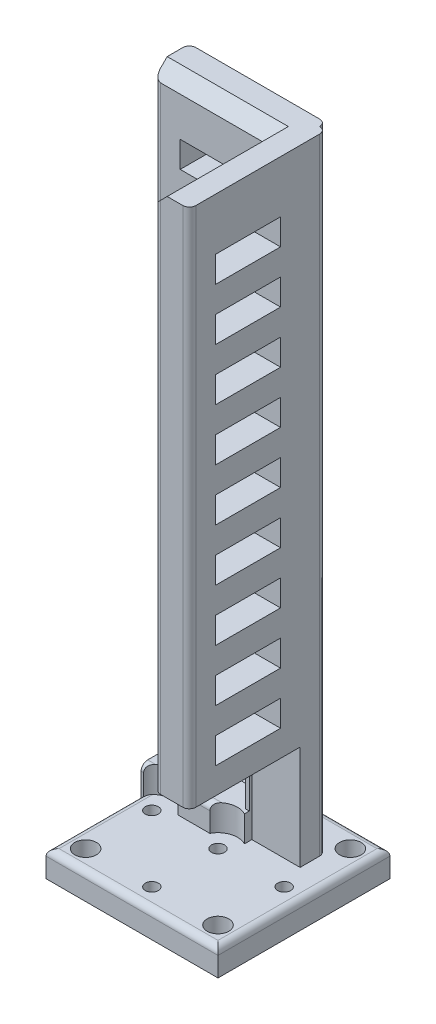
from build123d import *

# Parameters (mm, degrees)
BOSS_EXTRUDE2_DEPTH  = 250
SKETCH4_R            = 2.5
SKETCH4_W            = 36
SKETCH4_H            = 36
SKETCH4_R_2          = 4.15
BOSS_EXTRUDE3_DEPTH  = 10
SKETCH5_W            = 25
SKETCH5_H            = 10
CUT_EXTRUDE1_DEPTH   = 24
SKETCH6_W            = 25
SKETCH6_H            = 10
CUT_EXTRUDE2_DEPTH   = 24
CUT_EXTRUDE3_REACH   = 258.32
BOSS_EXTRUDE4_DEPTH  = 240
SKETCH10_W           = 25
SKETCH10_H           = 10
BOSS_EXTRUDE8_DEPTH  = 5
SKETCH11_W           = 25
SKETCH11_H           = 10
BOSS_EXTRUDE9_DEPTH  = 5
BOSS_EXTRUDE10_DEPTH = 10
SKETCH13_R           = 2.5
CUT_EXTRUDE4_DEPTH   = 20
SKETCH14_R           = 7.5
CUT_EXTRUDE5_DEPTH   = 10
CUT_EXTRUDE6_REACH   = 258.32
CHAMFER3_SIZE        = 5
FILLET1_R            = 2.5
SKETCH16_W           = 42.5
SKETCH16_H           = 40
CUT_EXTRUDE7_DEPTH   = 18.5
SKETCH18_W           = 10
SKETCH18_H           = 5
CUT_EXTRUDE9_DEPTH   = 30
FILLET2_R            = 2.5
CUT_EXTRUDE10_DEPTH  = 29.5


with BuildPart() as part:
    # Sketch3 → Boss-Extrude2 (new body)
    with BuildSketch(Plane(origin=(0, 0, 0), x_dir=(1, 0, 0), z_dir=(0, 1, 0))):
        Polygon((0, 0), (0, -36), (24, -36), (24, 0), (24, 24), (-36, 24), (-36, 0), align=None)
    extrude(amount=BOSS_EXTRUDE2_DEPTH)

    # Sketch4 → Boss-Extrude3 (add)
    # profile 1 of 3: a face of its own
    with BuildSketch(Plane.XZ):
        with Locations((-18.4, -7)):
            Circle(SKETCH4_R)
    # profile 2 of 3: a face of its own
    with BuildSketch(Plane.XZ):
        with Locations((-18, 18)):
            Rectangle(SKETCH4_W, SKETCH4_H)
        with Locations(Location((-18.4, 18.4, 0), (0, 0, 270))):
            Circle(SKETCH4_R_2, mode=Mode.SUBTRACT)
    # profile 3 of 3: a face of its own
    with BuildSketch(Plane.XZ):
        Polygon((-36, -24), (24, -24), (24, 36), (40, 36), (40, -24), (40, -40), (-36, -40), align=None)
        with Locations(Location((-18.4, -32.4, 0), (0, 0, 270))):
            Circle(SKETCH4_R_2, mode=Mode.SUBTRACT)
        with Locations(Location((32.4, 18.4, 0), (0, 0, 270))):
            Circle(SKETCH4_R_2, mode=Mode.SUBTRACT)
        with Locations(Location((32.4, -32.4, 0), (0, 0, 270))):
            Circle(SKETCH4_R_2, mode=Mode.SUBTRACT)
        with Locations(Location((32.4, -7, 0), (0, 0, 270))):
            Circle(SKETCH4_R, mode=Mode.SUBTRACT)
        with Locations(Location((7, -32.4, 0), (0, 0, 270))):
            Circle(SKETCH4_R, mode=Mode.SUBTRACT)
    extrude(amount=-BOSS_EXTRUDE3_DEPTH)

    # Sketch5 → Cut-Extrude1 (cut)
    with BuildSketch(Plane.XY):
        with Locations((-3.5, 25)):
            Rectangle(SKETCH5_W, SKETCH5_H)
        with Locations((-3.5, 45)):
            Rectangle(SKETCH5_W, SKETCH5_H)
        with Locations((-3.5, 65)):
            Rectangle(SKETCH5_W, SKETCH5_H)
        with Locations((-3.5, 85)):
            Rectangle(SKETCH5_W, SKETCH5_H)
        with Locations((-3.5, 105)):
            Rectangle(SKETCH5_W, SKETCH5_H)
        with Locations((-3.5, 125)):
            Rectangle(SKETCH5_W, SKETCH5_H)
        with Locations((-3.5, 145)):
            Rectangle(SKETCH5_W, SKETCH5_H)
        with Locations((-3.5, 165)):
            Rectangle(SKETCH5_W, SKETCH5_H)
        with Locations((-3.5, 185)):
            Rectangle(SKETCH5_W, SKETCH5_H)
        with Locations((-3.5, 205)):
            Rectangle(SKETCH5_W, SKETCH5_H)
        with Locations((-3.5, 225)):
            Rectangle(SKETCH5_W, SKETCH5_H)
    extrude(amount=-CUT_EXTRUDE1_DEPTH, mode=Mode.SUBTRACT)

    # Sketch6 → Cut-Extrude2 (cut)
    with BuildSketch(Plane.ZY):
        with Locations((3.5, 25)):
            Rectangle(SKETCH6_W, SKETCH6_H)
        with Locations((3.5, 45)):
            Rectangle(SKETCH6_W, SKETCH6_H)
        with Locations((3.5, 65)):
            Rectangle(SKETCH6_W, SKETCH6_H)
        with Locations((3.5, 85)):
            Rectangle(SKETCH6_W, SKETCH6_H)
        with Locations((3.5, 105)):
            Rectangle(SKETCH6_W, SKETCH6_H)
        with Locations((3.5, 125)):
            Rectangle(SKETCH6_W, SKETCH6_H)
        with Locations((3.5, 145)):
            Rectangle(SKETCH6_W, SKETCH6_H)
        with Locations((3.5, 165)):
            Rectangle(SKETCH6_W, SKETCH6_H)
        with Locations((3.5, 185)):
            Rectangle(SKETCH6_W, SKETCH6_H)
        with Locations((3.5, 205)):
            Rectangle(SKETCH6_W, SKETCH6_H)
        with Locations((3.5, 225)):
            Rectangle(SKETCH6_W, SKETCH6_H)
    extrude(amount=-CUT_EXTRUDE2_DEPTH, mode=Mode.SUBTRACT)

    # Cut-Extrude3: up to this face of the body (flat: up to its plane)
    cut_extrude3_end = Plane(part.part.faces().sort_by_distance((-18, 10, 0.509116882))[0])
    # Sketch7 → Cut-Extrude3 (cut, up to the picked face)
    with BuildSketch(Plane(origin=(0, 250, 0), x_dir=(1, 0, 0), z_dir=(0, 1, 0)), mode=Mode.PRIVATE) as cut_extrude3_sk1:
        Polygon((-36, 0), (0, 0), (0, -36), (15.5, -36), (15.5, 0), (15.5, 15.5), (-36, 15.5), align=None)
    cut_extrude3_tool1 = split(extrude(cut_extrude3_sk1.sketch, amount=-CUT_EXTRUDE3_REACH, mode=Mode.PRIVATE), bisect_by=cut_extrude3_end, keep=Keep.BOTH, mode=Mode.PRIVATE)
    add(cut_extrude3_tool1.solids().sort_by(Axis((-18, 250, -0.72832), (0, -1, 0)))[0], mode=Mode.SUBTRACT)

    # Sketch8 → Boss-Extrude4 (add)
    with BuildSketch(Plane(origin=(0, 10, 0), x_dir=(1, 0, 0), z_dir=(0, 1, 0))):
        Polygon((14, 24), (14, 29), (26.5, 29), (26.5, 26.5), (29, 26.5), (29, 14), (24, 14), (24, 24), align=None)
    extrude(amount=BOSS_EXTRUDE4_DEPTH)

    # Sketch10 → Boss-Extrude8 (add)
    with BuildSketch(Plane(origin=(24, 0, 0), x_dir=(0, 0, -1), z_dir=(1, 0, 0))):
        Polygon((-36, 250), (14, 250), (14, 20), (9, 20), (9, 30), (-16, 30), (-16, 20), (-36, 20), align=None)
        with Locations((-3.5, 45)):
            Rectangle(SKETCH10_W, SKETCH10_H, mode=Mode.SUBTRACT)
        with Locations((-3.5, 65)):
            Rectangle(SKETCH10_W, SKETCH10_H, mode=Mode.SUBTRACT)
        with Locations((-3.5, 125)):
            Rectangle(SKETCH10_W, SKETCH10_H, mode=Mode.SUBTRACT)
        with Locations((-3.5, 105)):
            Rectangle(SKETCH10_W, SKETCH10_H, mode=Mode.SUBTRACT)
        with Locations((-3.5, 85)):
            Rectangle(SKETCH10_W, SKETCH10_H, mode=Mode.SUBTRACT)
        with Locations((-3.5, 225)):
            Rectangle(SKETCH10_W, SKETCH10_H, mode=Mode.SUBTRACT)
        with Locations((-3.5, 205)):
            Rectangle(SKETCH10_W, SKETCH10_H, mode=Mode.SUBTRACT)
        with Locations((-3.5, 185)):
            Rectangle(SKETCH10_W, SKETCH10_H, mode=Mode.SUBTRACT)
        with Locations((-3.5, 165)):
            Rectangle(SKETCH10_W, SKETCH10_H, mode=Mode.SUBTRACT)
        with Locations((-3.5, 145)):
            Rectangle(SKETCH10_W, SKETCH10_H, mode=Mode.SUBTRACT)
    extrude(amount=BOSS_EXTRUDE8_DEPTH)

    # Sketch11 → Boss-Extrude9 (add)
    with BuildSketch(Plane(origin=(0, 0, -24), x_dir=(-1, 0, 0), z_dir=(0, 0, -1))):
        Polygon((-9, 20), (-14, 20), (-14, 250), (36, 250), (36, 20), (16, 20), (16, 30), (-9, 30), align=None)
        with Locations((3.5, 225)):
            Rectangle(SKETCH11_W, SKETCH11_H, mode=Mode.SUBTRACT)
        with Locations((3.5, 205)):
            Rectangle(SKETCH11_W, SKETCH11_H, mode=Mode.SUBTRACT)
        with Locations((3.5, 185)):
            Rectangle(SKETCH11_W, SKETCH11_H, mode=Mode.SUBTRACT)
        with Locations((3.5, 165)):
            Rectangle(SKETCH11_W, SKETCH11_H, mode=Mode.SUBTRACT)
        with Locations((3.5, 145)):
            Rectangle(SKETCH11_W, SKETCH11_H, mode=Mode.SUBTRACT)
        with Locations((3.5, 125)):
            Rectangle(SKETCH11_W, SKETCH11_H, mode=Mode.SUBTRACT)
        with Locations((3.5, 105)):
            Rectangle(SKETCH11_W, SKETCH11_H, mode=Mode.SUBTRACT)
        with Locations((3.5, 85)):
            Rectangle(SKETCH11_W, SKETCH11_H, mode=Mode.SUBTRACT)
        with Locations((3.5, 65)):
            Rectangle(SKETCH11_W, SKETCH11_H, mode=Mode.SUBTRACT)
        with Locations((3.5, 45)):
            Rectangle(SKETCH11_W, SKETCH11_H, mode=Mode.SUBTRACT)
    extrude(amount=BOSS_EXTRUDE9_DEPTH)

    # Sketch12 → Boss-Extrude10 (add)
    with BuildSketch(Plane(origin=(0, 10, 0), x_dir=(1, 0, 0), z_dir=(0, 1, 0))):
        Polygon((-36, 10.5), (10.5, 10.5), (10.5, -36), (15.5, -36), (15.5, 10.5), (15.5, 15.5), (-36, 15.5), align=None)
    extrude(amount=BOSS_EXTRUDE10_DEPTH)

    # Sketch13 → Cut-Extrude4 (cut)
    with BuildSketch(Plane.XZ):
        with Locations(Location((7, 18.4, 0), (0, 0, 270))):
            Circle(SKETCH13_R)
        with Locations(Location((-18.4, -7, 0), (0, 0, 270))):
            Circle(SKETCH13_R)
        with Locations(Location((7, -7, 0), (0, 0, 270))):
            Circle(SKETCH13_R)
    extrude(amount=-CUT_EXTRUDE4_DEPTH, mode=Mode.SUBTRACT)

    # Sketch14 → Cut-Extrude5 (cut)
    with BuildSketch(Plane(origin=(0, 20, 0), x_dir=(1, 0, 0), z_dir=(0, 1, 0))):
        with Locations((-18.4, 7)):
            Circle(SKETCH14_R)
        with Locations((7, 7)):
            Circle(SKETCH14_R)
        with Locations((7, -18.4)):
            Circle(SKETCH14_R)
    extrude(amount=-CUT_EXTRUDE5_DEPTH, mode=Mode.SUBTRACT)

    # Cut-Extrude6: up to this face of the body (flat: up to its plane)
    cut_extrude6_end = Plane(part.part.faces().sort_by_distance((1.711979496, 0, -1.711979496))[0])
    # Sketch15 → Cut-Extrude6 (cut, up to the picked face)
    with BuildSketch(Plane(origin=(0, 250, 0), x_dir=(1, 0, 0), z_dir=(0, 1, 0)), mode=Mode.PRIVATE) as cut_extrude6_sk1:
        Polygon((-36, 40), (-26, 40), (-26, -26), (40, -26), (40, -36), (-26, -36), (-36, -36), align=None)
    cut_extrude6_tool1 = split(extrude(cut_extrude6_sk1.sketch, amount=-CUT_EXTRUDE6_REACH, mode=Mode.PRIVATE), bisect_by=cut_extrude6_end, keep=Keep.BOTH, mode=Mode.PRIVATE)
    add(cut_extrude6_tool1.solids().sort_by(Axis((-31, 250, -38.925198), (0, -1, 0)))[0], mode=Mode.SUBTRACT)

    # Chamfer3
    chamfer3_edges = [part.edges().sort_by_distance(p)[0] for p in [
        (15.5, 250, 5.25),
        (-5.25, 250, -15.5),
    ]]
    chamfer(chamfer3_edges, length=CHAMFER3_SIZE)

    # Fillet1
    # the kernel refuses this fillet: 2.5 mm, written as the material it takes off along each edge
    with BuildSketch(Plane(origin=(40, 10, -46.25), x_dir=(-1, 0, 0), z_dir=(0, 0, 1))) as fillet1_piece_1:
        with BuildLine():
            CenterArc((FILLET1_R, FILLET1_R), FILLET1_R, 180, 90)
            Line((0, FILLET1_R), (0, 0))
            Line((0, 0), (FILLET1_R, 0))
        make_face()
    extrude(amount=78.5, mode=Mode.SUBTRACT)
    with BuildSketch(Plane(origin=(46.25, 10, -40), x_dir=(0, 0, 1), z_dir=(-1, 0, 0))) as fillet1_piece_2:
        with BuildLine():
            CenterArc((FILLET1_R, -FILLET1_R), FILLET1_R, 90, 90)
            Line((0, -FILLET1_R), (0, 0))
            Line((0, 0), (FILLET1_R, 0))
        make_face()
    extrude(amount=78.5, mode=Mode.SUBTRACT)
    with BuildSketch(Plane(origin=(10.5, 20, 18.783249581), x_dir=(1, 0, 0), z_dir=(0, 0, 1)), Plane(origin=(-32.25, 20, -10.5), x_dir=(0, 0, -1), z_dir=(1, 0, 0))) as fillet1_piece_3:
        with BuildLine():
            CenterArc((FILLET1_R, -FILLET1_R), FILLET1_R, 90, 90)
            Line((0, -FILLET1_R), (0, 0))
            Line((0, 0), (FILLET1_R, 0))
        make_face()
    extrude(amount=13.466750419, mode=Mode.SUBTRACT)
    with BuildSketch(Plane(origin=(10.5, 20, -6.616750419), x_dir=(1, 0, 0), z_dir=(0, 0, 1)), Plane(origin=(-18.016750419, 20, -10.5), x_dir=(0, 0, -1), z_dir=(1, 0, 0))) as fillet1_piece_4:
        with BuildLine():
            CenterArc((FILLET1_R, -FILLET1_R), FILLET1_R, 90, 90)
            Line((0, -FILLET1_R), (0, 0))
            Line((0, 0), (FILLET1_R, 0))
        make_face()
    extrude(amount=24.633500839, mode=Mode.SUBTRACT)
    with BuildSketch(Plane(origin=(-32.25, 20, -29), x_dir=(0, 1, 0), z_dir=(1, 0, 0)), Plane(origin=(29, 20, 9.75), x_dir=(0, 1, 0), z_dir=(0, 0, 1))) as fillet1_piece_5:
        with BuildLine():
            CenterArc((FILLET1_R, FILLET1_R), FILLET1_R, 180, 90)
            Line((0, FILLET1_R), (0, 0))
            Line((0, 0), (FILLET1_R, 0))
        make_face()
    extrude(amount=22.5, mode=Mode.SUBTRACT)
    with BuildSketch(Plane(origin=(2.75, 20, -29), x_dir=(0, 1, 0), z_dir=(1, 0, 0)), Plane(origin=(29, 20, -14), x_dir=(0, 1, 0), z_dir=(0, 0, 1))) as fillet1_piece_6:
        with BuildLine():
            CenterArc((FILLET1_R, FILLET1_R), FILLET1_R, 180, 90)
            Line((0, FILLET1_R), (0, 0))
            Line((0, 0), (FILLET1_R, 0))
        make_face()
    extrude(amount=11.25, mode=Mode.SUBTRACT)
    with BuildSketch(Plane(origin=(26.5, 10, -29), x_dir=(-1, 0, 0), z_dir=(0, 1, 0))) as fillet1_piece_7:
        with BuildLine():
            CenterArc((FILLET1_R, FILLET1_R), FILLET1_R, 180, 90)
            Line((0, FILLET1_R), (0, 0))
            Line((0, 0), (FILLET1_R, 0))
        make_face()
    extrude(amount=246.25, mode=Mode.SUBTRACT)
    with BuildSketch(Plane(origin=(29, 10, -26.5), x_dir=(0, 0, 1), z_dir=(0, 1, 0))) as fillet1_piece_8:
        with BuildLine():
            CenterArc((FILLET1_R, -FILLET1_R), FILLET1_R, 90, 90)
            Line((0, -FILLET1_R), (0, 0))
            Line((0, 0), (FILLET1_R, 0))
        make_face()
    extrude(amount=246.25, mode=Mode.SUBTRACT)
    with BuildSketch(Plane(origin=(14, 10, -29), x_dir=(1, 0, 0), z_dir=(0, 1, 0)), Plane(origin=(24, 10, 26), x_dir=(-1, 0, 0), z_dir=(0, 1, 0)), Plane(origin=(-26, 20, -24), x_dir=(0, 0, 1), z_dir=(0, -1, 0))) as fillet1_piece_9:
        with BuildLine():
            CenterArc((FILLET1_R, -FILLET1_R), FILLET1_R, 90, 90)
            Line((0, -FILLET1_R), (0, 0))
            Line((0, 0), (FILLET1_R, 0))
        make_face()
    extrude(amount=10, mode=Mode.SUBTRACT)
    with BuildSketch(Plane(origin=(29, 10, -14), x_dir=(0, 0, -1), z_dir=(0, 1, 0))) as fillet1_piece_10:
        with BuildLine():
            CenterArc((FILLET1_R, FILLET1_R), FILLET1_R, 180, 90)
            Line((0, FILLET1_R), (0, 0))
            Line((0, 0), (FILLET1_R, 0))
        make_face()
    extrude(amount=10, mode=Mode.SUBTRACT)
    with BuildSketch(Plane(origin=(15.5, 251.25, 26), x_dir=(1, 0, 0), z_dir=(0, -1, 0)), Plane(origin=(-26, 20, -15.5), x_dir=(0, 0, -1), z_dir=(0, 1, 0))) as fillet1_piece_11:
        with BuildLine():
            CenterArc((FILLET1_R, -FILLET1_R), FILLET1_R, 90, 90)
            Line((0, -FILLET1_R), (0, 0))
            Line((0, 0), (FILLET1_R, 0))
        make_face()
    extrude(amount=231.25, mode=Mode.SUBTRACT)
    with BuildSketch(Plane(origin=(29, 256.25, 26), x_dir=(-1, 0, 0), z_dir=(0, -1, 0)), Plane(origin=(-26, 13.75, -29), x_dir=(0, 0, 1), z_dir=(0, 1, 0))) as fillet1_piece_12:
        with BuildLine():
            CenterArc((FILLET1_R, FILLET1_R), FILLET1_R, 180, 90)
            Line((0, FILLET1_R), (0, 0))
            Line((0, 0), (FILLET1_R, 0))
        make_face()
    extrude(amount=242.5, mode=Mode.SUBTRACT)
    with BuildSketch(Plane(origin=(-26, 10, -46.25), x_dir=(1, 0, 0), z_dir=(0, 0, 1))) as fillet1_piece_13:
        with BuildLine():
            CenterArc((FILLET1_R, -FILLET1_R), FILLET1_R, 90, 90)
            Line((0, -FILLET1_R), (0, 0))
            Line((0, 0), (FILLET1_R, 0))
        make_face()
    extrude(amount=22.25, mode=Mode.SUBTRACT)
    with BuildSketch(Plane(origin=(24, 10, 26), x_dir=(0, -1, 0), z_dir=(1, 0, 0))) as fillet1_piece_14:
        with BuildLine():
            CenterArc((FILLET1_R, FILLET1_R), FILLET1_R, 180, 90)
            Line((0, FILLET1_R), (0, 0))
            Line((0, 0), (FILLET1_R, 0))
        make_face()
    extrude(amount=22.25, mode=Mode.SUBTRACT)
    with BuildSketch(Plane(origin=(-32.25, 10, 26), x_dir=(0, -1, 0), z_dir=(1, 0, 0))) as fillet1_piece_15_section:
        with BuildLine():
            CenterArc((FILLET1_R, FILLET1_R), FILLET1_R, 180, 90)
            Line((0, FILLET1_R), (0, 0))
            Line((0, 0), (FILLET1_R, 0))
        make_face()
    fillet1_piece_15 = extrude(amount=42.75, mode=Mode.PRIVATE)
    fillet1_piece_15 = fillet1_piece_15 - Plane(origin=(7, 9.40882375, 18.4), x_dir=(1, 0, 0), z_dir=(0, 1, 0)) * Cylinder(7.5, 96, mode=Mode.PRIVATE)
    add(fillet1_piece_15, mode=Mode.SUBTRACT)
    with BuildSketch(Plane(origin=(-32.25, 10, 26), x_dir=(0, -1, 0), z_dir=(1, 0, 0))) as fillet1_piece_16_section:
        with BuildLine():
            CenterArc((FILLET1_R, FILLET1_R), FILLET1_R, 180, 90)
            Line((0, FILLET1_R), (0, 0))
            Line((0, 0), (FILLET1_R, 0))
        make_face()
    fillet1_piece_16 = extrude(amount=42.75, mode=Mode.PRIVATE)
    fillet1_piece_16 = fillet1_piece_16 & Plane(origin=(7, 9.675188109, 18.4), x_dir=(1, 0, 0), z_dir=(0, 1, 0)) * Cylinder(7.5, 96, mode=Mode.PRIVATE)
    add(fillet1_piece_16, mode=Mode.SUBTRACT)
    with BuildSketch(Plane(origin=(-32.25, 10, 26), x_dir=(0, -1, 0), z_dir=(1, 0, 0))) as fillet1_piece_17_section:
        with BuildLine():
            CenterArc((FILLET1_R, FILLET1_R), FILLET1_R, 180, 90)
            Line((0, FILLET1_R), (0, 0))
            Line((0, 0), (FILLET1_R, 0))
        make_face()
    fillet1_piece_17 = extrude(amount=49, mode=Mode.PRIVATE)
    fillet1_piece_17 = split(fillet1_piece_17, bisect_by=Plane(origin=(10.5, 9.941139166, 24.304322203), z_dir=(1, 0, 0)), keep=Keep.TOP, mode=Mode.PRIVATE)
    fillet1_piece_17 = fillet1_piece_17 & Plane(origin=(7, 9.941139166, 18.4), x_dir=(1, 0, 0), z_dir=(0, 1, 0)) * Cylinder(7.5, 108, mode=Mode.PRIVATE)
    add(fillet1_piece_17, mode=Mode.SUBTRACT)
    with BuildSketch(Plane(origin=(-26, 10, -10.5), x_dir=(1, 0, 0), z_dir=(0, 0, 1))) as fillet1_piece_18_section:
        with BuildLine():
            CenterArc((FILLET1_R, -FILLET1_R), FILLET1_R, 90, 90)
            Line((0, -FILLET1_R), (0, 0))
            Line((0, 0), (FILLET1_R, 0))
        make_face()
    fillet1_piece_18 = extrude(amount=42.75, mode=Mode.PRIVATE)
    fillet1_piece_18 = fillet1_piece_18 - Plane(origin=(-18.4, 9.408829706, -7), x_dir=(1, 0, 0), z_dir=(0, 1, 0)) * Cylinder(7.5, 96, mode=Mode.PRIVATE)
    add(fillet1_piece_18, mode=Mode.SUBTRACT)
    with BuildSketch(Plane(origin=(-26, 10, -16.75), x_dir=(1, 0, 0), z_dir=(0, 0, 1))) as fillet1_piece_19_section:
        with BuildLine():
            CenterArc((FILLET1_R, -FILLET1_R), FILLET1_R, 90, 90)
            Line((0, -FILLET1_R), (0, 0))
            Line((0, 0), (FILLET1_R, 0))
        make_face()
    fillet1_piece_19 = extrude(amount=49, mode=Mode.PRIVATE)
    fillet1_piece_19 = split(fillet1_piece_19, bisect_by=Plane(origin=(-24.304322269, 9.94113913, -10.5), z_dir=(0, 0, -1)), keep=Keep.TOP, mode=Mode.PRIVATE)
    fillet1_piece_19 = fillet1_piece_19 & Plane(origin=(-18.4, 9.94113913, -7), x_dir=(1, 0, 0), z_dir=(0, 1, 0)) * Cylinder(7.5, 108, mode=Mode.PRIVATE)
    add(fillet1_piece_19, mode=Mode.SUBTRACT)
    with BuildSketch(Plane(origin=(-26, 10, -10.5), x_dir=(1, 0, 0), z_dir=(0, 0, 1))) as fillet1_piece_20_section:
        with BuildLine():
            CenterArc((FILLET1_R, -FILLET1_R), FILLET1_R, 90, 90)
            Line((0, -FILLET1_R), (0, 0))
            Line((0, 0), (FILLET1_R, 0))
        make_face()
    fillet1_piece_20 = extrude(amount=42.75, mode=Mode.PRIVATE)
    fillet1_piece_20 = fillet1_piece_20 & Plane(origin=(-18.4, 9.675156176, -7), x_dir=(1, 0, 0), z_dir=(0, 1, 0)) * Cylinder(7.5, 96, mode=Mode.PRIVATE)
    add(fillet1_piece_20, mode=Mode.SUBTRACT)
    with BuildSketch(Plane(origin=(2.75, 20, -29), x_dir=(0, 1, 0), z_dir=(1, 0, 0))) as fillet1_piece_21a_section:
        with BuildLine():
            CenterArc((FILLET1_R, FILLET1_R), FILLET1_R, 180, 90)
            Line((0, FILLET1_R), (0, 0))
            Line((0, 0), (FILLET1_R, 0))
        make_face()
    fillet1_piece_21a = extrude(amount=17.5, mode=Mode.PRIVATE)
    fillet1_piece_21a = split(fillet1_piece_21a, bisect_by=Plane(origin=(14, 20.565987786, -28.434012214), z_dir=(1, 0, 0)), keep=Keep.TOP, mode=Mode.PRIVATE)
    with BuildSketch(Plane(origin=(14, 10, -29), x_dir=(1, 0, 0), z_dir=(0, 1, 0))) as fillet1_piece_21b_section:
        with BuildLine():
            CenterArc((FILLET1_R, -FILLET1_R), FILLET1_R, 90, 90)
            Line((0, -FILLET1_R), (0, 0))
            Line((0, 0), (FILLET1_R, 0))
        make_face()
    fillet1_piece_21b = extrude(amount=16.25, mode=Mode.PRIVATE)
    fillet1_piece_21b = split(fillet1_piece_21b, bisect_by=Plane(origin=(14.565987786, 20, -28.434012214), z_dir=(0, 1, 0)), keep=Keep.TOP, mode=Mode.PRIVATE)
    fillet1_piece_21 = fillet1_piece_21a & fillet1_piece_21b
    add(fillet1_piece_21, mode=Mode.SUBTRACT)
    with BuildSketch(Plane(origin=(29, 10, -14), x_dir=(0, 0, -1), z_dir=(0, 1, 0))) as fillet1_piece_22a_section:
        with BuildLine():
            CenterArc((FILLET1_R, FILLET1_R), FILLET1_R, 180, 90)
            Line((0, FILLET1_R), (0, 0))
            Line((0, 0), (FILLET1_R, 0))
        make_face()
    fillet1_piece_22a = extrude(amount=16.25, mode=Mode.PRIVATE)
    fillet1_piece_22a = split(fillet1_piece_22a, bisect_by=Plane(origin=(28.434012214, 20, -14.565987786), z_dir=(0, 1, 0)), keep=Keep.TOP, mode=Mode.PRIVATE)
    with BuildSketch(Plane(origin=(29, 20, -20.25), x_dir=(0, 1, 0), z_dir=(0, 0, 1))) as fillet1_piece_22b_section:
        with BuildLine():
            CenterArc((FILLET1_R, FILLET1_R), FILLET1_R, 180, 90)
            Line((0, FILLET1_R), (0, 0))
            Line((0, 0), (FILLET1_R, 0))
        make_face()
    fillet1_piece_22b = extrude(amount=17.5, mode=Mode.PRIVATE)
    fillet1_piece_22b = split(fillet1_piece_22b, bisect_by=Plane(origin=(28.434012214, 20.565987786, -14), z_dir=(0, 0, -1)), keep=Keep.TOP, mode=Mode.PRIVATE)
    fillet1_piece_22 = fillet1_piece_22a & fillet1_piece_22b
    add(fillet1_piece_22, mode=Mode.SUBTRACT)
    with BuildSketch(Plane(origin=(24, 3.75, 26), x_dir=(-1, 0, 0), z_dir=(0, 1, 0))) as fillet1_piece_23a_section:
        with BuildLine():
            CenterArc((FILLET1_R, -FILLET1_R), FILLET1_R, 90, 90)
            Line((0, -FILLET1_R), (0, 0))
            Line((0, 0), (FILLET1_R, 0))
        make_face()
    fillet1_piece_23a = extrude(amount=16.25, mode=Mode.PRIVATE)
    fillet1_piece_23a = split(fillet1_piece_23a, bisect_by=Plane(origin=(23.434012214, 10, 25.434012214), z_dir=(0, -1, 0)), keep=Keep.TOP, mode=Mode.PRIVATE)
    with BuildSketch(Plane(origin=(17.75, 10, 26), x_dir=(0, -1, 0), z_dir=(1, 0, 0))) as fillet1_piece_23b_section:
        with BuildLine():
            CenterArc((FILLET1_R, FILLET1_R), FILLET1_R, 180, 90)
            Line((0, FILLET1_R), (0, 0))
            Line((0, 0), (FILLET1_R, 0))
        make_face()
    fillet1_piece_23b = extrude(amount=28.5, mode=Mode.PRIVATE)
    fillet1_piece_23b = split(fillet1_piece_23b, bisect_by=Plane(origin=(24, 9.434012214, 25.434012214), z_dir=(-1, 0, 0)), keep=Keep.TOP, mode=Mode.PRIVATE)
    fillet1_piece_23 = fillet1_piece_23a & fillet1_piece_23b
    add(fillet1_piece_23, mode=Mode.SUBTRACT)
    with BuildSketch(Plane(origin=(-26, 10, -46.25), x_dir=(1, 0, 0), z_dir=(0, 0, 1))) as fillet1_piece_24a_section:
        with BuildLine():
            CenterArc((FILLET1_R, -FILLET1_R), FILLET1_R, 90, 90)
            Line((0, -FILLET1_R), (0, 0))
            Line((0, 0), (FILLET1_R, 0))
        make_face()
    fillet1_piece_24a = extrude(amount=28.5, mode=Mode.PRIVATE)
    fillet1_piece_24a = split(fillet1_piece_24a, bisect_by=Plane(origin=(-25.434012214, 9.434012214, -24), z_dir=(0, 0, 1)), keep=Keep.TOP, mode=Mode.PRIVATE)
    with BuildSketch(Plane(origin=(-26, 20, -24), x_dir=(0, 0, 1), z_dir=(0, -1, 0))) as fillet1_piece_24b_section:
        with BuildLine():
            CenterArc((FILLET1_R, -FILLET1_R), FILLET1_R, 90, 90)
            Line((0, -FILLET1_R), (0, 0))
            Line((0, 0), (FILLET1_R, 0))
        make_face()
    fillet1_piece_24b = extrude(amount=16.25, mode=Mode.PRIVATE)
    fillet1_piece_24b = split(fillet1_piece_24b, bisect_by=Plane(origin=(-25.434012214, 10, -23.434012214), z_dir=(0, -1, 0)), keep=Keep.TOP, mode=Mode.PRIVATE)
    fillet1_piece_24 = fillet1_piece_24a & fillet1_piece_24b
    add(fillet1_piece_24, mode=Mode.SUBTRACT)

    # Sketch16 → Cut-Extrude7 (cut)
    with BuildSketch(Plane(origin=(29, 0, 0), x_dir=(0, 0, -1), z_dir=(1, 0, 0))):
        with Locations((-4.75, 30)):
            Rectangle(SKETCH16_W, SKETCH16_H)
    extrude(amount=-CUT_EXTRUDE7_DEPTH, mode=Mode.SUBTRACT)

    # Sketch18 → Cut-Extrude9 (cut)
    with BuildSketch(Plane.XZ.offset(-20)):
        with Locations((-21, -26.5)):
            Rectangle(SKETCH18_W, SKETCH18_H)
    extrude(amount=-CUT_EXTRUDE9_DEPTH, mode=Mode.SUBTRACT)

    # Fillet2
    fillet2_edges = [part.edges().sort_by_distance(p)[0] for p in [
        (-26, 35, -24),
        (-16, 35, -29),
    ]]
    fillet(fillet2_edges, radius=FILLET2_R)

    # Sketch19 → Cut-Extrude10 (cut)
    with BuildSketch(Plane.ZY.offset(-10.5)):
        with BuildLine():
            Line((23.5, 10), (27.3342247, 10))
            Line((27.3342247, 10), (27.3342247, 7.5))
            Line((27.3342247, 7.5), (26, 7.5))
            ThreePointArc((26, 7.5), (25.745342285, 8.599289782), (25.033249581, 9.474625464))
            ThreePointArc((25.033249581, 9.474625464), (24.310381497, 9.865012015), (23.5, 10))
        make_face()
    extrude(amount=-CUT_EXTRUDE10_DEPTH, mode=Mode.SUBTRACT)


solid = part.part
